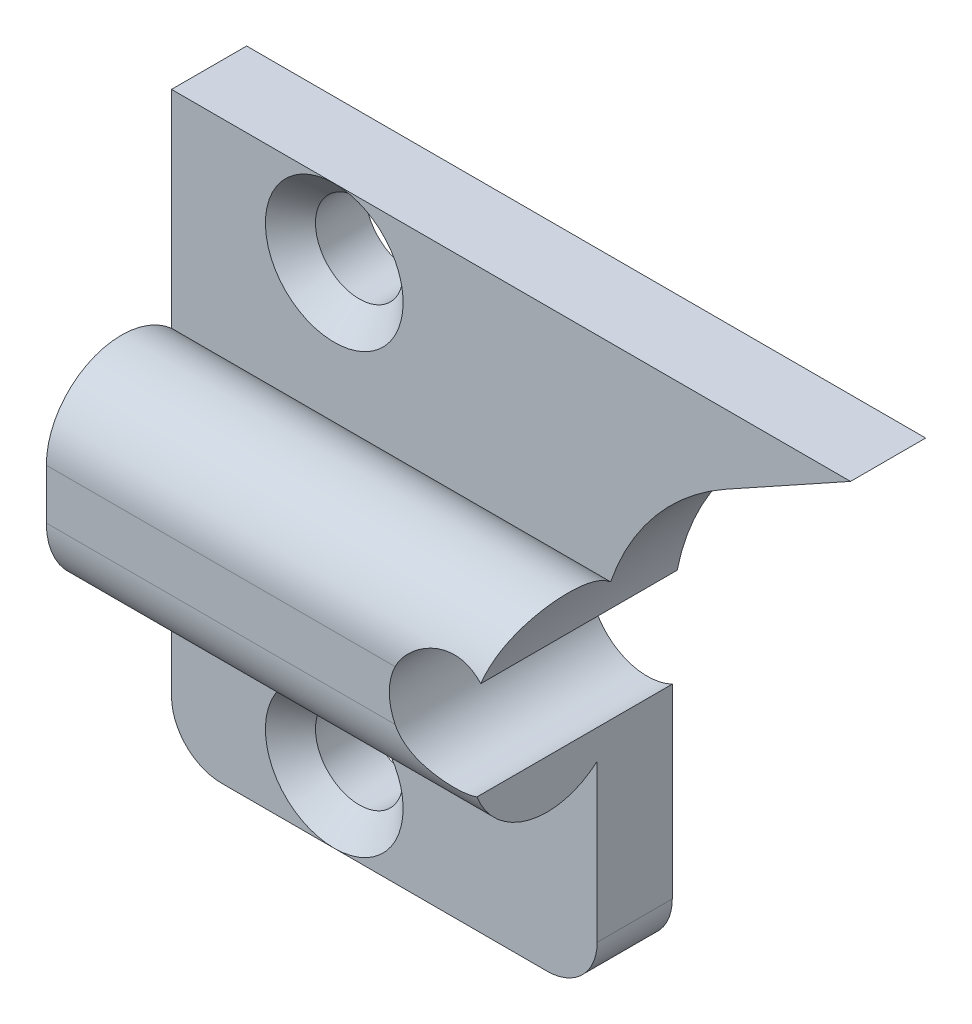
from build123d import *
from build123d.topology import SkipClean

# Parameters (mm, degrees)
CROQUIS3_W              = 38
CROQUIS3_H              = 23
CROQUIS3_R              = 1.75
SALIENTE_EXTRUIR1_DEPTH = 1
SALIENTE_EXTRUIR2_DEPTH = 25
SALIENTE_EXTRUIR4_DEPTH = 40
SALIENTE_EXTRUIR5_DEPTH = 6
CORTAR_EXTRUIR3_DEPTH   = 65.46296637
CROQUIS5_R              = 1.75
CORTAR_EXTRUIR1_DEPTH   = 12
CROQUIS11_R             = 1.75
CORTAR_EXTRUIR4_DEPTH   = 58.245149126
CORTAR_EXTRUIR5_DEPTH   = 58.134007224
REDONDEO1_R             = 2
SALIENTE_EXTRUIR6_START = 2
CROQUIS13_R             = 1.75
SALIENTE_EXTRUIR6_DEPTH = 2
CHAFL_N1_SIZE           = 1
CORTAR_EXTRUIR6_DEPTH   = 64.102925108
SALIENTE_EXTRUIR7_DEPTH = 3


with BuildPart() as part:
    # Croquis3 → Saliente-Extruir1 (new body)
    with BuildSketch(Plane.XY.offset(-3)):
        with Locations((22, 0)):
            Rectangle(CROQUIS3_W, CROQUIS3_H)
        with Locations((9.5, 8.75)):
            Circle(CROQUIS3_R, mode=Mode.SUBTRACT)
        with Locations((9.5, -8.75)):
            Circle(CROQUIS3_R, mode=Mode.SUBTRACT)
        with BuildLine():
            ThreePointArc((20.184659091, -1.912872928), (40, 0), (20.184659091, 1.912872928))
            ThreePointArc((20.184659091, 1.912872928), (16.75, 0), (20.184659091, -1.912872928))
        make_face(mode=Mode.SUBTRACT)
    extrude(amount=SALIENTE_EXTRUIR1_DEPTH)

    # Croquis4 → Saliente-Extruir2 (add)
    with BuildSketch(Plane(origin=(3, 0, 0), x_dir=(0, 0, -1), z_dir=(1, 0, 0))):
        with BuildLine():
            Line((3, 1), (3, -1))
            ThreePointArc((3, -1), (0, -4), (-3, -1))
            Line((-3, -1), (-3, 1))
            ThreePointArc((-3, 1), (0, 4), (3, 1))
        make_face()
    extrude(amount=SALIENTE_EXTRUIR2_DEPTH)



with BuildPart() as body_2:
    # Croquis8 → Saliente-Extruir4 (new body)
    with BuildSketch(Plane(origin=(49, 0, 0), x_dir=(0.8746197071393935, 0.48480962024634133, 0), z_dir=(-0.48480962024634133, 0.8746197071393935, 0))):
        with BuildLine():
            Line((-1, 3), (1, 3))
            ThreePointArc((1, 3), (4, 0), (1, -3))
            Line((1, -3), (-1, -3))
            ThreePointArc((-1, -3), (-4, 0), (-1, 3))
        make_face()
    extrude(amount=SALIENTE_EXTRUIR4_DEPTH)


with BuildPart() as part_1:
    add(part.part)

    add(body_2.part)  # Saliente-Extruir5 merges body 2
    # Croquis9 → Saliente-Extruir5 (add)
    with BuildSketch(Plane.XY.offset(-3)):
        with BuildLine():
            Line((25.151903798, 8.746197071), (39.686136808, 16.802653985))
            Line((39.686136808, 16.802653985), (36.292469466, 22.924991935))
            Line((36.292469466, 22.924991935), (21.758236456, 14.868535021))
            ThreePointArc((21.758236456, 14.868535021), (15.352304272, 8.62815217), (13, 0))
            Line((13, 0), (20, 0))
            ThreePointArc((20, 0), (21.383708396, 5.07538363), (25.151903798, 8.746197071))
        make_face()
    extrude(amount=SALIENTE_EXTRUIR5_DEPTH)

    # Croquis10 → Cortar-Extruir3 (cut, through all)
    with BuildSketch(Plane(origin=(0, 0, -3), x_dir=(-1, 0, 0), z_dir=(0, 0, -1))):
        with BuildLine():
            Line((-54.752227431, 25.153924387), (-25.151903798, 8.746197071))
            ThreePointArc((-25.151903798, 8.746197071), (-21.926969684, 5.901371155), (-20.195, 1.96519083))
            ThreePointArc((-20.195, 1.96519083), (-16.702679258, 0.110983813), (-20, -2.071231518))
            Line((-20, -2.071231518), (-20, -15.393420546))
            Line((-20, -15.393420546), (-54.752227431, -15.393420546))
            Line((-54.752227431, -15.393420546), (-54.752227431, 25.153924387))
        make_face()
    extrude(amount=-CORTAR_EXTRUIR3_DEPTH, mode=Mode.SUBTRACT)

    # Croquis5 → Cortar-Extruir1 (cut)
    with BuildSketch(Plane(origin=(3, 0, 0), x_dir=(0, 0, -1), z_dir=(1, 0, 0))):
        Circle(CROQUIS5_R)
    extrude(amount=CORTAR_EXTRUIR1_DEPTH, mode=Mode.SUBTRACT)

    # Croquis11 → Cortar-Extruir4 (cut, through all)
    with BuildSketch(Plane(origin=(-7.875406784, 14.20760993, 0), x_dir=(0.8746197071393934, 0.4848096202463414, 0), z_dir=(-0.48480962024634144, 0.8746197071393935, 0))):
        with Locations(Location((42.85636565, 0, 0), (0, 0, 180))):
            Circle(CROQUIS11_R)
    extrude(amount=-CORTAR_EXTRUIR4_DEPTH, mode=Mode.SUBTRACT)

    # Croquis12 → Cortar-Extruir5 (cut, through all)
    with BuildSketch(Plane(origin=(0, 0, -3), x_dir=(-1, 0, 0), z_dir=(0, 0, -1))):
        Polygon((-41.818249172, 31.029855201), (-23.89343012, 27.219817295), (-26.84914243, 44.519393877), align=None)
    extrude(amount=-CORTAR_EXTRUIR5_DEPTH, mode=Mode.SUBTRACT)

    # Redondeo1
    redondeo1_edges = [part_1.edges().sort_by_distance(p)[0] for p in [
        (20, -11.5, -2.5),
        (3, 11.5, -2.5),
        (3, -11.5, -2.5),
    ]]
    fillet(redondeo1_edges, radius=REDONDEO1_R)

    # Croquis13 → Saliente-Extruir6 (add)
    with SkipClean():  # the faces are left unmerged after this step: merging them gives an invalid solid
        with BuildSketch(Plane(origin=(0, 0, -3), x_dir=(-1, 0, 0), z_dir=(0, 0, -1)).offset(SALIENTE_EXTRUIR6_START)):
            with BuildLine():
                Line((-20, -2.071231518), (-20, -9.5))
                ThreePointArc((-20, -9.5), (-19.414213562, -10.914213562), (-18, -11.5))
                Line((-18, -11.5), (-5, -11.5))
                ThreePointArc((-5, -11.5), (-3.585786438, -10.914213562), (-3, -9.5))
                Line((-3, -9.5), (-3, 9.5))
                ThreePointArc((-3, 9.5), (-3.585786438, 10.914213562), (-5, 11.5))
                Line((-5, 11.5), (-17.480015974, 11.5))
                ThreePointArc((-17.480015974, 11.5), (-19.483379935, 13.35667258), (-21.758236456, 14.868535021))
                Line((-21.758236456, 14.868535021), (-35.417849759, 22.440182315))
                Line((-35.417849759, 22.440182315), (-31.832998763, 28.907424707))
                Line((-31.832998763, 28.907424707), (-33.878680529, 29.342247789))
                Line((-33.878680529, 29.342247789), (-40.560756515, 17.287463605))
                Line((-40.560756515, 17.287463605), (-25.151903798, 8.746197071))
                ThreePointArc((-25.151903798, 8.746197071), (-21.926969684, 5.901371155), (-20.195, 1.96519083))
                ThreePointArc((-20.195, 1.96519083), (-16.702679258, 0.110983813), (-20, -2.071231518))
            make_face()
            with Locations((-9.5, -8.75)):
                Circle(CROQUIS13_R, mode=Mode.SUBTRACT)
            with Locations((-9.5, 8.75)):
                Circle(CROQUIS13_R, mode=Mode.SUBTRACT)
        extrude(amount=-SALIENTE_EXTRUIR6_DEPTH)

    # Chaflán1
    chafl_n1_edges = [part_1.edges().sort_by_distance(p)[0] for p in [
        (7.75, 8.75, -2),
        (7.75, -8.75, -2),
    ]]
    chamfer(chafl_n1_edges, length=CHAFL_N1_SIZE - 0.0001)  # a hair under: the kernel refuses the full size

    # Croquis14 → Cortar-Extruir6 (cut, through all)
    with BuildSketch(Plane(origin=(3, 0.024746159, -35.327414791), x_dir=(0, 0, 1), z_dir=(-1, 0, 0))):
        with BuildLine():
            ThreePointArc((-38.672585209, 3.211321818), (-41.89733008, 3.713866628), (-43.672585209, 0.975253841))
            Line((-43.672585209, 0.975253841), (-43.672585209, 29.969736253))
            Line((-43.672585209, 29.969736253), (-35.672585209, 29.969736253))
            Line((-35.672585209, 29.969736253), (-35.672585209, 11.475253841))
            Line((-35.672585209, 11.475253841), (-38.672585209, 11.475253841))
            Line((-38.672585209, 11.475253841), (-38.672585209, 3.211321818))
        make_face()
        with BuildLine():
            Line((30.327414791, 11.475253841), (33.327414791, 11.475253841))
            Line((33.327414791, 11.475253841), (33.327414791, 9.475253841))
            Line((33.327414791, 9.475253841), (33.327414791, 3.211321818))
            ThreePointArc((33.327414791, 3.211321818), (36.552159663, 3.713866628), (38.327414791, 0.975253841))
            Line((38.327414791, 0.975253841), (38.327414791, 29.969736253))
            Line((38.327414791, 29.969736253), (30.327414791, 29.969736253))
            Line((30.327414791, 29.969736253), (30.327414791, 11.475253841))
        make_face()
    extrude(amount=-CORTAR_EXTRUIR6_DEPTH, mode=Mode.SUBTRACT)

    # Croquis15 → Saliente-Extruir7 (add)
    with BuildSketch(Plane.XY.offset(-2)):
        with BuildLine():
            Line((3, 9.5), (3, 11.5))
            Line((3, 11.5), (5, 11.5))
            ThreePointArc((5, 11.5), (3.585786438, 10.914213562), (3, 9.5))
        make_face()
    extrude(amount=-SALIENTE_EXTRUIR7_DEPTH)


solid = part_1.part
